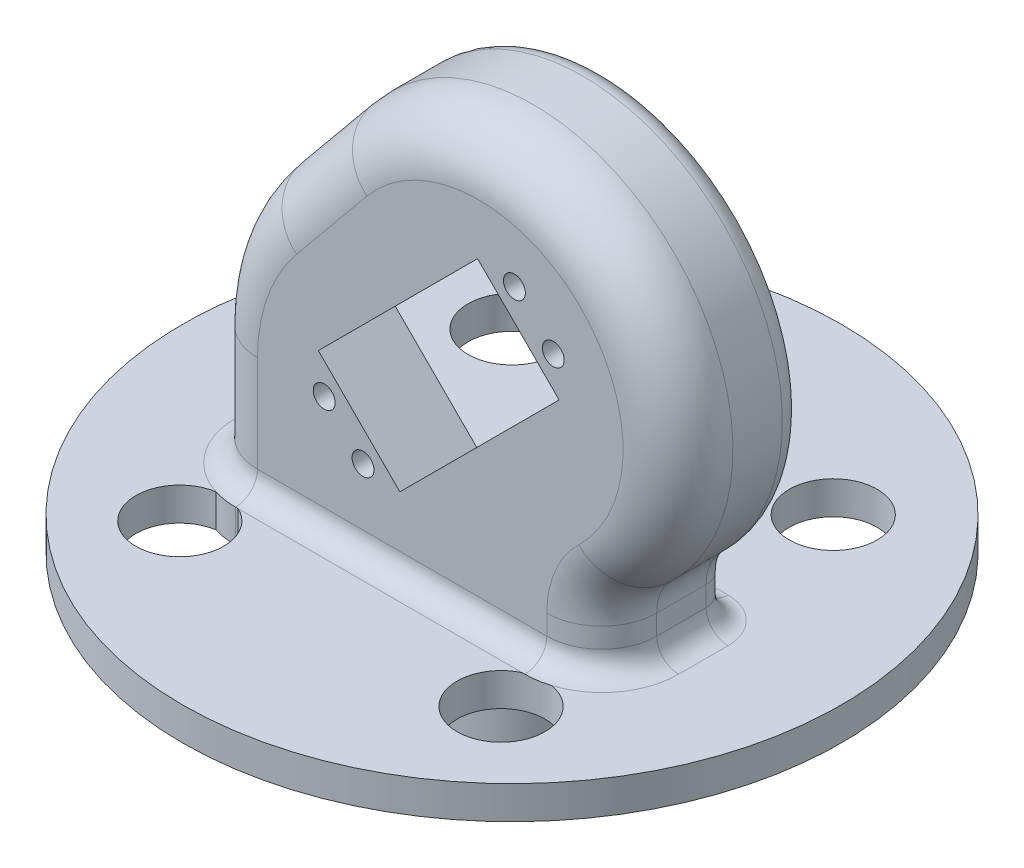
from build123d import *

# Parameters (mm, degrees)
SKETCH1_R                = 59.99999999999994
SKETCH1_R_2              = 1.4999999999999996
BOSS_EXTRUDE2_DEPTH      = 4
BOSS_EXTRUDE3_START      = 6
SKETCH8_R                = 9
BOSS_EXTRUDE3_DEPTH      = 14
SKETCH9_R                = 1.4999999999999996
SKETCH9_R_2              = 1.4999999999999993
BOSS_EXTRUDE4_DEPTH      = 4
BOSS_EXTRUDE8_START      = -23
BOSS_EXTRUDE8_DEPTH      = 23
SKETCH35_R               = 1.6000000000000008
SKETCH35_R_2             = 1.600000000000028
SKETCH35_R_3             = 1.6000000000000338
SKETCH35_R_4             = 1.6000000000000019
CUT_EXTRUDE6_DEPTH       = 14
FILLET1_R                = 10
FILLET2_R                = 4
FILLET3_R                = 4
BOSS_EXTRUDE9_START      = 2
SKETCH40_R               = 59.99999999999994
BOSS_EXTRUDE9_DEPTH      = 2
SKETCH42_R               = 1.9950000000000014
SKETCH42_R_2             = 1.6000000000000008
SKETCH42_R_3             = 1.600000000000028
SKETCH42_R_4             = 1.6000000000000019
SKETCH42_R_5             = 1.9950000000000008
SKETCH42_R_6             = 1.6000000000000336
CUT_EXTRUDE7_DEPTH       = 14
SKETCH44_R               = 12.5
BOSS_EXTRUDE10_DEPTH     = 16
SKETCH46_R               = 1
CUT_EXTRUDE8_DEPTH       = 22
SKETCH47_R               = 1.5
CUT_EXTRUDE9_DEPTH       = 22
SKETCH51_R               = 0.7500000000000002
SKETCH51_R_2             = 0.7500000000000001
SKETCH51_R_3             = 0.7499999999999999
SKETCH51_R_4             = 0.7499999999999998
SKETCH51_R_5             = 0.7499999999999992
SKETCH51_R_6             = 0.75
CUT_EXTRUDE11_DEPTH      = 13.5
SKETCH53_R               = 10.5
CUT_EXTRUDE13_DEPTH      = 2.5
SKETCH55_R               = 2.1
CUT_EXTRUDE14_DEPTH      = 18.5
SKETCH56_R               = 1.5000000000000002
SKETCH56_R_2             = 1.25
BOSS_EXTRUDE12_DEPTH     = 1
SKETCH57_R               = 4.625
CUT_EXTRUDE15_DEPTH      = 0.8
SKETCH58_R               = 15.635
BOSS_EXTRUDE13_DEPTH     = 4
CUT_EXTRUDE16_DEPTH      = 2.5
CUT_EXTRUDE18_DEPTH      = 129.19419354899156
CUT_EXTRUDE18_DEPTH_BACK = 9.5
SKETCH60_R               = 0.7500000000000082
SKETCH60_R_2             = 0.7499999999999998
SKETCH60_R_3             = 0.7500000000000038
SKETCH60_R_4             = 0.7574970144449374
BOSS_EXTRUDE14_START     = 2.5
BOSS_EXTRUDE14_DEPTH     = 2.5
BOSS_EXTRUDE17_START     = 2.5
SKETCH62_R               = 0.7499999999999983
SKETCH62_R_2             = 4.625
SKETCH62_R_3             = 0.7499999999999992
SKETCH62_R_4             = 0.7499999999999998
SKETCH62_R_5             = 0.7500000000000002
SKETCH62_R_6             = 0.75
SKETCH62_R_7             = 0.7500000000000003
SKETCH62_R_8             = 0.7500000000000001
SKETCH62_R_9             = 0.7574970144449374
BOSS_EXTRUDE17_DEPTH     = 2.5
BOSS_EXTRUDE20_START     = 2.5
SKETCH63_R               = 4.625
SKETCH63_R_2             = 1.25
BOSS_EXTRUDE20_DEPTH     = 2.5
SKETCH64_R               = 12.5
SKETCH64_R_2             = 12
CUT_EXTRUDE19_DEPTH      = 14.5
BOSS_EXTRUDE21_START     = 7
BOSS_EXTRUDE21_DEPTH     = 7
BOSS_EXTRUDE22_START     = 7
SKETCH73_R               = 4.625
SKETCH73_R_2             = 0.7499999999999998
SKETCH73_R_3             = 0.75
SKETCH73_R_4             = 0.7500000000000002
SKETCH73_R_5             = 0.7500000000000003
SKETCH73_R_6             = 0.7500000000000001
SKETCH73_R_7             = 0.7574970144449374
SKETCH73_R_8             = 0.7499999999999992
SKETCH73_R_9             = 0.7499999999999983
BOSS_EXTRUDE22_DEPTH     = 7
BOSS_EXTRUDE24_START     = 7
SKETCH74_R               = 4.625
SKETCH74_R_2             = 1.25
BOSS_EXTRUDE24_DEPTH     = 7
CUT_EXTRUDE20_START      = -6
CUT_EXTRUDE20_OUTLINE_R  = 8
CUT_EXTRUDE20_DEPTH      = 6
BOSS_EXTRUDE25_START     = 5.65
BOSS_EXTRUDE25_DEPTH     = 5.65
BOSS_EXTRUDE26_START     = 5.65
SKETCH80_R               = 0.7499999999999998
SKETCH80_R_2             = 0.7500000000000002
SKETCH80_R_3             = 0.7500000000000001
SKETCH80_R_4             = 0.7574970144449374
SKETCH80_R_5             = 0.7499999999999983
SKETCH80_R_6             = 0.7499999999999992
SKETCH80_R_7             = 0.7500000000000003
SKETCH80_R_8             = 0.75
SKETCH80_R_9             = 4.625
BOSS_EXTRUDE26_DEPTH     = 5.65
BOSS_EXTRUDE27_START     = 5.65
SKETCH81_R               = 4.625
SKETCH81_R_2             = 1.25
BOSS_EXTRUDE27_DEPTH     = 5.65
CUT_EXTRUDE21_DEPTH      = 7
SKETCH83_R               = 0.7500000000000002
SKETCH83_R_2             = 0.7500000000000001
SKETCH83_R_3             = 0.7499999999999998
SKETCH83_R_4             = 0.7499999999999992
SKETCH83_R_5             = 0.7500000000000003
SKETCH83_R_6             = 4.625
SKETCH83_R_7             = 0.75
SKETCH83_R_8             = 0.7499999999999983
SKETCH83_R_9             = 0.7574970144449374
CUT_EXTRUDE22_DEPTH      = 7
SKETCH84_R               = 4.625
CUT_EXTRUDE23_DEPTH      = 7


# Read off the part's stored shape, not the designer's step: Boss-Extrude8, Cut-Extrude20
with BuildPart() as part:
    # Sketch1 → Boss-Extrude2 (new body)
    with BuildSketch(Plane(origin=(0, 0, 0), x_dir=(1, 0, 0), z_dir=(0, 1, 0))):
        with Locations(Location((0, 0, 0), (0, 0, 270))):
            Circle(SKETCH1_R)
        with Locations(Location((-2.66e-15, 7.250000000000006, 0), (0, 0, 270))):
            Circle(SKETCH1_R_2, mode=Mode.SUBTRACT)
        with Locations(Location((0, -7.250000000000006, 0), (0, 0, 270))):
            Circle(SKETCH1_R_2, mode=Mode.SUBTRACT)
    extrude(amount=BOSS_EXTRUDE2_DEPTH)

    # Sketch8 → Boss-Extrude3 (add)
    # profile 1 of 2: a face of its own
    with BuildSketch(Plane.XY.offset(BOSS_EXTRUDE3_START)):
        with BuildLine():
            ThreePointArc((-30.34, 25.56864618431717), (-28.274775782359406, 37.45353353362877), (-22.321234896064333, 47.945008610574284))
            Line((-22.321234896064333, 47.945008610574284), (-9.502946601571894, 63.532951239605495))
            ThreePointArc((-9.502946601571894, 63.532951239605495), (34.48863209419088, 66.53673159146734), (34.93556554151656, 22.44498697820235))
            ThreePointArc((34.93556554151656, 22.44498697820235), (31.53662148462827, 17.510838233282723), (30.34, 11.640000000000006))
            Line((30.34, 11.640000000000006), (30.34, 3.999999999999999))
            Line((30.34, 3.999999999999999), (-30.34, 4.000000000000022))
            Line((-30.34, 4.000000000000022), (-30.34, 25.56864618431717))
        make_face()
        with Locations((13.909999999999995, 44.28000000000003)):
            Circle(SKETCH8_R, mode=Mode.SUBTRACT)
    # profile 2 of 2: a face of its own
    with BuildSketch(Plane.XY.offset(BOSS_EXTRUDE3_START)):
        with Locations((13.909999999999995, 44.28000000000003)):
            Circle(SKETCH8_R)
    extrude(amount=BOSS_EXTRUDE3_DEPTH)

    # Sketch9 → Boss-Extrude4 (add)
    with BuildSketch(Plane.XZ):
        with Locations((-2.66e-15, -7.250000000000006)):
            Circle(SKETCH9_R)
        with Locations((-3.1e-16, 7.250000000000006)):
            Circle(SKETCH9_R_2)
    extrude(amount=-BOSS_EXTRUDE4_DEPTH)

    # Boss-Extrude8 outline → Boss-Extrude8 (add)
    with BuildSketch(Plane.XY.offset(20).offset(BOSS_EXTRUDE8_START)):
        with BuildLine():
            Line((-36.34, 4), (-27.34, 4))
            ThreePointArc((-27.34, 4), (-23.163645431, 35.187308549), (-9.502946602, 63.53295124))
            ThreePointArc((-9.502946602, 63.53295124), (34.488632094, 66.536731591), (34.935565542, 22.444986978))
            ThreePointArc((34.935565542, 22.444986978), (31.536621485, 17.510838233), (30.34, 11.64))
            Line((30.34, 11.64), (30.34, 4))
            Line((30.34, 4), (36.34, 4))
            Line((36.34, 4), (36.34, 11.64))
            ThreePointArc((36.34, 11.64), (37.057972891, 15.16250294), (39.097339325, 18.122992187))
            ThreePointArc((39.097339325, 18.122992187), (38.561940438, 70.942200822), (-14.137275565, 67.343855996))
            Line((-14.137275565, 67.343855996), (-26.955563859, 51.755913367))
            ThreePointArc((-26.955563859, 51.755913367), (-33.923048694, 39.477641512), (-36.34, 25.568646184))
            Line((-36.34, 25.568646184), (-36.34, 4))
        make_face()
    extrude(amount=BOSS_EXTRUDE8_DEPTH)

    # Sketch35 → Cut-Extrude6 (cut)
    with BuildSketch(Plane.XY.offset(20)):
        with Locations((20.442578977191182, 60.15066365293005)):
            Circle(SKETCH35_R)
        with Locations((27.513646789056658, 53.07959584106458)):
            Circle(SKETCH35_R_2)
        with Locations((-7.120443353460411, 18.445505698547514)):
            Circle(SKETCH35_R_3)
        with Locations((-14.191511165325878, 25.51657351041299)):
            Circle(SKETCH35_R_4)
        Polygon((-15.259242404917531, 32.227016863873246), (13.73213562373086, 61.218394892521744), (28.581378028648402, 46.369152487604296), (-0.40999999999997444, 17.377774458955773), align=None)
    extrude(amount=-CUT_EXTRUDE6_DEPTH, mode=Mode.SUBTRACT)

    # Fillet1
    fillet1_edges = [part.edges().sort_by_distance(p)[0] for p in [
        (-36.34, 14.784323092, 20),
        (-20.546419712000002, 59.549884681500004, 20),
        (37.05797289097803, 15.162502939948338, 20),
        (36.34, 7.82, 20),
        (38.561940437889646, 70.94220082210202, 20),
        (-33.92304869387061, 39.47764151236106, 20),
    ]]
    fillet(fillet1_edges, radius=FILLET1_R)

    # Fillet2
    fillet2_edges = [part.edges().sort_by_distance(p)[0] for p in [
        (-33.92304869387061, 39.47764151236106, -3),
        (38.561940437889646, 70.94220082210202, -3),
        (-36.34, 14.784323092, -3),
        (-20.546419712000002, 59.549884681500004, -3),
        (37.05797289097803, 15.162502939948338, -3),
        (36.34, 7.82, -3),
    ]]
    fillet(fillet2_edges, radius=FILLET2_R)

    # Fillet3
    fillet3_edges = [part.edges().sort_by_distance(p)[0] for p in [
        (0, 4, 20),
        (33.41106781186548, 4, 17.071067811865476),
        (-33.41106781186548, 4, 17.07106781186548),
        (-29.840000000000003, 4, -3),
        (36.34, 4, 5.5),
        (-36.34, 4, 5.5),
        (35.168427124746195, 4, -1.8284271247461916),
        (-35.168427124746195, 4, -1.8284271247461912),
        (31.34, 4, -3),
    ]]
    fillet(fillet3_edges, radius=FILLET3_R)

    # Sketch40 → Boss-Extrude9 (add)
    with BuildSketch(Plane.XZ.offset(BOSS_EXTRUDE9_START)):
        with Locations(Location((0, 0, 0), (0, 0, 270))):
            Circle(SKETCH40_R)
    extrude(amount=-BOSS_EXTRUDE9_DEPTH)

    # Sketch42 → Cut-Extrude7 (cut)
    # profile 1 of 4: a face of its own
    with BuildSketch(Plane.XY.offset(20)):
        with Locations((20.442578977191182, 60.15066365293005)):
            Circle(SKETCH42_R)
        with Locations((20.442578977191182, 60.15066365293005)):
            Circle(SKETCH42_R_2, mode=Mode.SUBTRACT)
    # profile 2 of 4: a face of its own
    with BuildSketch(Plane.XY.offset(20)):
        with Locations((27.513646789056658, 53.07959584106458)):
            Circle(SKETCH42_R)
        with Locations((27.513646789056658, 53.07959584106458)):
            Circle(SKETCH42_R_3, mode=Mode.SUBTRACT)
    # profile 3 of 4: a face of its own
    with BuildSketch(Plane.XY.offset(20)):
        with Locations((-14.191511165325878, 25.51657351041299)):
            Circle(SKETCH42_R)
        with Locations((-14.191511165325878, 25.51657351041299)):
            Circle(SKETCH42_R_4, mode=Mode.SUBTRACT)
    # profile 4 of 4: a face of its own
    with BuildSketch(Plane.XY.offset(20)):
        with Locations((-7.120443353460411, 18.445505698547514)):
            Circle(SKETCH42_R_5)
        with Locations((-7.120443353460411, 18.445505698547514)):
            Circle(SKETCH42_R_6, mode=Mode.SUBTRACT)
    extrude(amount=-CUT_EXTRUDE7_DEPTH, mode=Mode.SUBTRACT)

    # Sketch44 → Boss-Extrude10 (add)
    with BuildSketch(Plane.XZ.offset(2)):
        with Locations(Location((0, 0, 0), (0, 0, 270))):
            Circle(SKETCH44_R)
    extrude(amount=BOSS_EXTRUDE10_DEPTH)

    # Sketch46 → Cut-Extrude8 (cut)
    with BuildSketch(Plane.XZ.offset(18.000000000000004)):
        with Locations(Location((0, 0, 0), (0, 0, 270))):
            Circle(SKETCH46_R)
    extrude(amount=-CUT_EXTRUDE8_DEPTH, mode=Mode.SUBTRACT)

    # Sketch47 → Cut-Extrude9 (cut)
    with BuildSketch(Plane.XZ.offset(18.000000000000004)):
        with Locations(Location((0, 0, 0), (0, 0, 270))):
            Circle(SKETCH47_R)
    extrude(amount=-CUT_EXTRUDE9_DEPTH, mode=Mode.SUBTRACT)

    # Sketch51 → Cut-Extrude11 (cut)
    with BuildSketch(Plane.XZ.offset(18.000000000000004)):
        with Locations(Location((-7.5, -9.2e-16, 0), (0, 0, 270))):
            Circle(SKETCH51_R)
        with Locations(Location((-7.500000000000011, 3.1999999999999993, 0), (0, 0, 270))):
            Circle(SKETCH51_R_2)
        with Locations(Location((7.5, -9.2e-16, 0), (0, 0, 90))):
            Circle(SKETCH51_R)
        with Locations(Location((7.500000000000011, 3.1999999999999993, 0), (0, 0, 90))):
            Circle(SKETCH51_R_2)
        with Locations(Location((0, 7.5, 0), (0, 0, 270))):
            Circle(SKETCH51_R_3)
        with Locations(Location((3.2, 7.5, 0), (0, 0, 270))):
            Circle(SKETCH51_R_4)
        with Locations(Location((-3.2, 7.5, 0), (0, 0, 90))):
            Circle(SKETCH51_R_4)
        with Locations(Location((3.200000000000002, -7.5, 0), (0, 0, 90))):
            Circle(SKETCH51_R_5)
        with Locations(Location((1.84e-15, -7.5, 0), (0, 0, 90))):
            Circle(SKETCH51_R_6)
        with Locations(Location((-3.1999999999999984, -7.5, 0), (0, 0, 270))):
            Circle(SKETCH51_R)
        with Locations(Location((7.500000000000011, -3.1999999999999975, 0), (0, 0, 270))):
            Circle(SKETCH51_R_2)
        with Locations(Location((-7.500000000000011, -3.200000000000001, 0), (0, 0, 90))):
            Circle(SKETCH51_R_2)
    extrude(amount=-CUT_EXTRUDE11_DEPTH, mode=Mode.SUBTRACT)

    # Sketch53 → Cut-Extrude13 (cut)
    with BuildSketch(Plane.XZ.offset(18.000000000000004)):
        with Locations(Location((0, 0, 0), (0, 0, 270))):
            Circle(SKETCH53_R)
    extrude(amount=-CUT_EXTRUDE13_DEPTH, mode=Mode.SUBTRACT)

    # Sketch55 → Cut-Extrude14 (cut)
    with BuildSketch(Plane(origin=(0, 4, 0), x_dir=(1, 0, 0), z_dir=(0, 1, 0))):
        with Locations(Location((0, 0, 0), (0, 0, 270))):
            Circle(SKETCH55_R)
    extrude(amount=-CUT_EXTRUDE14_DEPTH, mode=Mode.SUBTRACT)

    # Sketch56 → Boss-Extrude12 (add)
    with BuildSketch(Plane.XZ.offset(15.500000000000002)):
        Circle(SKETCH56_R)
        with Locations(Location((0, 0, 0), (0, 0, 270))):
            Circle(SKETCH56_R_2, mode=Mode.SUBTRACT)
    extrude(amount=-BOSS_EXTRUDE12_DEPTH)

    # Sketch57 → Cut-Extrude15 (cut)
    with BuildSketch(Plane.XZ.offset(15.500000000000002)):
        with Locations(Location((0, 0, 0), (0, 0, 270))):
            Circle(SKETCH57_R)
    extrude(amount=-CUT_EXTRUDE15_DEPTH, mode=Mode.SUBTRACT)

    # Sketch58 → Boss-Extrude13 (add)
    with BuildSketch(Plane.XZ.offset(2)):
        with Locations(Location((0, 0, 0), (0, 0, 270))):
            Circle(SKETCH58_R)
    extrude(amount=BOSS_EXTRUDE13_DEPTH)

    # Sketch59 → Cut-Extrude16 (cut)
    with BuildSketch(Plane.XZ.offset(18.000000000000004)):
        with BuildLine():
            ThreePointArc((-0.7156378338798501, 10.47558411214955), (3.707e-14, 11.45), (0.7156378338799193, 10.475584112149546))
            ThreePointArc((0.7156378338799211, 10.47558411214953), (2.5583579679476944, 10.183555592612954), (4.320303648370152, 9.570003990901965))
            Line((4.320303648369849, 9.570003990901801), (3.949567138225232, 11.859634034009925))
            ThreePointArc((3.9495671382254676, 11.85963403401005), (0, 12.5), (-3.9495671382254685, 11.85963403401005))
            Line((-3.949567138225234, 11.859634034009925), (-4.320303648369851, 9.5700039909018))
            ThreePointArc((-4.320303648370155, 9.570003990901965), (-2.5583579679476625, 10.183555592612962), (-0.7156378338798519, 10.475584112149535))
        make_face()
        with BuildLine():
            Line((11.859285638591711, 3.9506131349821465), (9.569850472212527, 4.320643695040924))
            ThreePointArc((9.569850472212437, 4.320643695040755), (10.183510138146612, 2.5585388928576367), (10.475584112149534, 0.7156378338798652))
            ThreePointArc((10.475584112149527, 0.7156378338798668), (11.449999999999998, -1.039e-14), (10.475584112149525, -0.7156378338798851))
            ThreePointArc((10.475584112149532, -0.7156378338798884), (10.183510138146612, -2.5585388928576354), (9.569850472212446, -4.320643695040731))
            Line((9.569850472212538, -4.320643695040902), (11.859285638591727, -3.950613134982127))
            ThreePointArc((11.859285638591693, -3.9506131349820652), (12.5, 1.688e-14), (11.859285638591682, 3.9506131349820977))
        make_face()
        with BuildLine():
            Line((-9.569850472212531, 4.320643695040917), (-11.859285638591711, 3.9506131349821394))
            ThreePointArc((-11.859285638591686, 3.9506131349820888), (-12.5, -1.78e-15), (-11.859285638591684, -3.9506131349820928))
            Line((-11.859285638591713, -3.9506131349821443), (-9.569850472212533, -4.320643695040918))
            ThreePointArc((-9.569850472212439, -4.320643695040749), (-10.183510138146609, -2.5585388928576465), (-10.475584112149532, -0.7156378338798928))
            ThreePointArc((-10.475584112149509, -0.7156378338798963), (-11.45, -2.526e-14), (-10.475584112149512, 0.7156378338798508))
            ThreePointArc((-10.475584112149535, 0.7156378338798486), (-10.183510138146614, 2.5585388928576247), (-9.569850472212439, 4.320643695040748))
        make_face()
        with BuildLine():
            Line((3.949567138225234, -11.859634034009918), (4.320303648369745, -9.570003990902453))
            ThreePointArc((4.320303648369439, -9.570003990902288), (2.5583579679473134, -10.183555592613049), (0.7156378338799181, -10.47558411214953))
            ThreePointArc((0.7156378338799191, -10.475584112149544), (3.849e-14, -11.45), (-0.7156378338798507, -10.475584112149551))
            ThreePointArc((-0.7156378338798586, -10.475584112149535), (-2.558357967947286, -10.183555592613057), (-4.320303648369443, -9.570003990902286))
            Line((-4.320303648369746, -9.570003990902451), (-3.949567138225234, -11.859634034009925))
            ThreePointArc((-3.9495671382254716, -11.85963403401005), (1.78e-15, -12.500000000000002), (3.9495671382254742, -11.85963403401005))
        make_face()
    extrude(amount=-CUT_EXTRUDE16_DEPTH, mode=Mode.SUBTRACT)

    # Sketch60 → Cut-Extrude18 (cut, two sides: drawn at the far end of the back side and taken through both)
    with BuildSketch(Plane.XZ.offset(15.500000000000002).offset(-CUT_EXTRUDE18_DEPTH_BACK)):
        with Locations(Location((3.516e-14, 10.7, 0), (0, 0, 270))):
            Circle(SKETCH60_R)
        with Locations(Location((3.516e-14, -10.7, 0), (0, 0, 270))):
            Circle(SKETCH60_R_2)
        with Locations(Location((10.7, -9.39e-15, 0), (0, 0, 270))):
            Circle(SKETCH60_R_3)
        with Locations(Location((-10.7, -2.326e-14, 0), (0, 0, 270))):
            Circle(SKETCH60_R_4)
    extrude(amount=CUT_EXTRUDE18_DEPTH + CUT_EXTRUDE18_DEPTH_BACK, mode=Mode.SUBTRACT)

    # Sketch61 → Boss-Extrude14 (add)
    with BuildSketch(Plane.XZ.offset(18.000000000000004).offset(BOSS_EXTRUDE14_START)):
        with BuildLine():
            Line((3.949567138225199, 11.859634034010142), (4.320303648369798, 9.570003990902128))
            ThreePointArc((4.320303648369798, 9.570003990902128), (7.4244892923568955, 7.424753110217054), (9.569850472212346, 4.320643695040953))
            Line((9.569850472212346, 4.320643695040953), (11.859285638591667, 3.9506131349821545))
            ThreePointArc((11.859285638591667, 3.9506131349821545), (8.838444966456654, 8.839224546017435), (3.949567138225199, 11.859634034010142))
        make_face()
        with BuildLine():
            Line((11.859285638591672, -3.9506131349821385), (9.569850472212357, -4.3206436950409355))
            ThreePointArc((9.569850472212357, -4.3206436950409355), (7.424489292356904, -7.424753110217047), (4.320303648369799, -9.570003990902128))
            Line((4.320303648369799, -9.570003990902128), (3.9495671382252, -11.859634034010142))
            ThreePointArc((3.9495671382252, -11.859634034010142), (8.83844496645666, -8.83922454601743), (11.859285638591672, -3.9506131349821385))
        make_face()
        with BuildLine():
            Line((-3.9495671382252016, -11.859634034010142), (-4.3203036483698005, -9.570003990902128))
            ThreePointArc((-4.3203036483698005, -9.570003990902128), (-7.4244892923568955, -7.424753110217051), (-9.569850472212346, -4.320643695040949))
            Line((-9.569850472212346, -4.320643695040949), (-11.859285638591667, -3.9506131349821536))
            ThreePointArc((-11.859285638591667, -3.9506131349821536), (-8.838444966456654, -8.839224546017435), (-3.9495671382252016, -11.859634034010142))
        make_face()
        with BuildLine():
            Line((-11.859285638591668, 3.9506131349821474), (-9.56985047221235, 4.320643695040947))
            ThreePointArc((-9.56985047221235, 4.320643695040947), (-7.424489292356899, 7.424753110217049), (-4.320303648369798, 9.570003990902126))
            Line((-4.320303648369798, 9.570003990902126), (-3.949567138225198, 11.85963403401014))
            ThreePointArc((-3.949567138225198, 11.85963403401014), (-8.838444966456656, 8.839224546017428), (-11.859285638591668, 3.9506131349821474))
        make_face()
    extrude(amount=-BOSS_EXTRUDE14_DEPTH)

    # Sketch62 → Boss-Extrude17 (add)
    with BuildSketch(Plane.XZ.offset(15.500000000000002).offset(BOSS_EXTRUDE17_START)):
        with BuildLine():
            Line((-11.859285638591667, -3.9506131349821545), (-9.569850472212352, -4.320643695040947))
            ThreePointArc((-9.569850472212352, -4.320643695040947), (-7.424489292356899, -7.424753110217055), (-4.320303648369798, -9.570003990902128))
            Line((-4.320303648369798, -9.570003990902128), (-3.9495671382252, -11.85963403401014))
            ThreePointArc((-3.9495671382252, -11.85963403401014), (7.7e-16, -12.500000000000002), (3.949567138225199, -11.85963403401014))
            Line((3.949567138225199, -11.85963403401014), (4.320303648369799, -9.570003990902126))
            ThreePointArc((4.320303648369799, -9.570003990902126), (7.424489292356904, -7.424753110217047), (9.569850472212355, -4.320643695040933))
            Line((9.569850472212355, -4.320643695040933), (11.859285638591672, -3.9506131349821376))
            ThreePointArc((11.859285638591672, -3.9506131349821376), (12.500000000000004, 9.71e-15), (11.859285638591667, 3.950613134982156))
            Line((11.859285638591667, 3.950613134982156), (9.56985047221235, 4.320643695040952))
            ThreePointArc((9.56985047221235, 4.320643695040952), (7.424489292356898, 7.424753110217056), (4.320303648369796, 9.570003990902128))
            Line((4.320303648369796, 9.570003990902128), (3.949567138225198, 11.85963403401014))
            ThreePointArc((3.949567138225198, 11.85963403401014), (7.7e-16, 12.5), (-3.9495671382252, 11.85963403401014))
            Line((-3.9495671382252, 11.85963403401014), (-4.320303648369798, 9.570003990902128))
            ThreePointArc((-4.320303648369798, 9.570003990902128), (-7.4244892923569, 7.4247531102170505), (-9.569850472212353, 4.320643695040945))
            Line((-9.569850472212353, 4.320643695040945), (-11.859285638591668, 3.950613134982149))
            ThreePointArc((-11.859285638591668, 3.950613134982149), (-12.500000000000004, -4.02e-15), (-11.859285638591667, -3.9506131349821545))
        make_face()
        with Locations(Location((10.7, -9.39e-15, 0), (0, 0, 270))):
            Circle(SKETCH62_R, mode=Mode.SUBTRACT)
        with Locations(Location((0, 0, 0), (0, 0, 270))):
            Circle(SKETCH62_R_2, mode=Mode.SUBTRACT)
        with Locations(Location((3.200000000000002, -7.5, 0), (0, 0, 270))):
            Circle(SKETCH62_R_3, mode=Mode.SUBTRACT)
        with Locations(Location((3.2, 7.5, 0), (0, 0, 270))):
            Circle(SKETCH62_R_4, mode=Mode.SUBTRACT)
        with Locations(Location((7.5, -9.2e-16, 0), (0, 0, 270))):
            Circle(SKETCH62_R_5, mode=Mode.SUBTRACT)
        with Locations(Location((0, 7.5, 0), (0, 0, 270))):
            Circle(SKETCH62_R_6, mode=Mode.SUBTRACT)
        with Locations(Location((7.500000000000011, -3.1999999999999975, 0), (0, 0, 270))):
            Circle(SKETCH62_R_5, mode=Mode.SUBTRACT)
        with Locations(Location((-7.5, -9.2e-16, 0), (0, 0, 270))):
            Circle(SKETCH62_R_5, mode=Mode.SUBTRACT)
        with Locations(Location((-7.500000000000011, -3.200000000000001, 0), (0, 0, 270))):
            Circle(SKETCH62_R_5, mode=Mode.SUBTRACT)
        with Locations(Location((-3.1999999999999984, -7.5, 0), (0, 0, 270))):
            Circle(SKETCH62_R_7, mode=Mode.SUBTRACT)
        with Locations(Location((7.500000000000011, 3.1999999999999993, 0), (0, 0, 270))):
            Circle(SKETCH62_R_5, mode=Mode.SUBTRACT)
        with Locations(Location((-7.500000000000011, 3.1999999999999993, 0), (0, 0, 270))):
            Circle(SKETCH62_R_5, mode=Mode.SUBTRACT)
        with Locations(Location((-3.2, 7.5, 0), (0, 0, 270))):
            Circle(SKETCH62_R_4, mode=Mode.SUBTRACT)
        with Locations(Location((1.84e-15, -7.5, 0), (0, 0, 270))):
            Circle(SKETCH62_R_8, mode=Mode.SUBTRACT)
        with Locations(Location((3.516e-14, -10.7, 0), (0, 0, 270))):
            Circle(SKETCH62_R_8, mode=Mode.SUBTRACT)
        with Locations(Location((3.516e-14, 10.7, 0), (0, 0, 270))):
            Circle(SKETCH62_R_8, mode=Mode.SUBTRACT)
        with Locations(Location((-10.7, -2.326e-14, 0), (0, 0, 270))):
            Circle(SKETCH62_R_9, mode=Mode.SUBTRACT)
    extrude(amount=-BOSS_EXTRUDE17_DEPTH)

    # Sketch63 → Boss-Extrude20 (add)
    with BuildSketch(Plane.XZ.offset(14.700000000000001).offset(BOSS_EXTRUDE20_START)):
        with Locations(Location((0, 0, 0), (0, 0, 270))):
            Circle(SKETCH63_R)
        with Locations(Location((0, 0, 0), (0, 0, 270))):
            Circle(SKETCH63_R_2, mode=Mode.SUBTRACT)
    extrude(amount=-BOSS_EXTRUDE20_DEPTH)

    # Sketch64 → Cut-Extrude19 (cut)
    with BuildSketch(Plane.XZ.offset(20.5)):
        Circle(SKETCH64_R)
        with Locations(Location((0, 0, 0), (0, 0, 270))):
            Circle(SKETCH64_R_2, mode=Mode.SUBTRACT)
    extrude(amount=-CUT_EXTRUDE19_DEPTH, mode=Mode.SUBTRACT)

    # Sketch72 → Boss-Extrude21 (add)
    with BuildSketch(Plane.XZ.offset(20.5).offset(BOSS_EXTRUDE21_START)):
        with BuildLine():
            Line((4.3203036483698, -9.57000399090213), (4.040282450144906, -11.299385723261734))
            ThreePointArc((4.040282450144906, -11.299385723261734), (8.48495273086531, -8.485610004883641), (11.299072727121294, -4.041157693931754))
            Line((11.299072727121294, -4.041157693931754), (9.569850472212359, -4.3206436950409355))
            ThreePointArc((9.569850472212359, -4.3206436950409355), (7.424489292356907, -7.42475311021705), (4.3203036483698, -9.57000399090213))
        make_face()
        with BuildLine():
            Line((9.569850472212346, 4.320643695040954), (11.299072727121288, 4.041157693931771))
            ThreePointArc((11.299072727121288, 4.041157693931771), (8.484952730865304, 8.485610004883648), (4.040282450144905, 11.299385723261736))
            Line((4.040282450144905, 11.299385723261736), (4.320303648369798, 9.57000399090213))
            ThreePointArc((4.320303648369798, 9.57000399090213), (7.4244892923568955, 7.424753110217054), (9.569850472212346, 4.320643695040954))
        make_face()
        with BuildLine():
            Line((-9.569850472212352, -4.320643695040945), (-11.299072727121288, -4.041157693931767))
            ThreePointArc((-11.299072727121288, -4.041157693931767), (-8.484952730865304, -8.485610004883647), (-4.040282450144907, -11.299385723261734))
            Line((-4.040282450144907, -11.299385723261734), (-4.320303648369805, -9.570003990902125))
            ThreePointArc((-4.320303648369805, -9.570003990902125), (-7.4244892923569035, -7.424753110217047), (-9.569850472212352, -4.320643695040945))
        make_face()
        with BuildLine():
            Line((-4.320303648369798, 9.570003990902128), (-4.040282450144903, 11.299385723261736))
            ThreePointArc((-4.040282450144903, 11.299385723261736), (-8.484952730865304, 8.485610004883647), (-11.29907272712129, 4.041157693931762))
            Line((-11.29907272712129, 4.041157693931762), (-9.569850472212348, 4.320643695040946))
            ThreePointArc((-9.569850472212348, 4.320643695040946), (-7.424489292356898, 7.424753110217054), (-4.320303648369798, 9.570003990902128))
        make_face()
    extrude(amount=-BOSS_EXTRUDE21_DEPTH)

    # Sketch73 → Boss-Extrude22 (add)
    with BuildSketch(Plane.XZ.offset(18.000000000000004).offset(BOSS_EXTRUDE22_START)):
        with BuildLine():
            ThreePointArc((4.320303648369798, -9.570003990902126), (7.424489292356904, -7.424753110217044), (9.569850472212355, -4.320643695040931))
            Line((9.569850472212355, -4.320643695040931), (11.299072727121295, -4.041157693931754))
            ThreePointArc((11.299072727121295, -4.041157693931754), (12.000000000000004, 8.66e-15), (11.299072727121288, 4.04115769393177))
            Line((11.299072727121288, 4.04115769393177), (9.569850472212346, 4.320643695040952))
            ThreePointArc((9.569850472212346, 4.320643695040952), (7.4244892923568955, 7.424753110217054), (4.320303648369797, 9.570003990902128))
            Line((4.320303648369797, 9.570003990902128), (4.040282450144904, 11.299385723261738))
            ThreePointArc((4.040282450144904, 11.299385723261738), (7.3e-16, 12.000000000000004), (-4.040282450144903, 11.299385723261736))
            Line((-4.040282450144903, 11.299385723261736), (-4.3203036483698, 9.570003990902126))
            ThreePointArc((-4.3203036483698, 9.570003990902126), (-7.4244892923569, 7.4247531102170505), (-9.56985047221235, 4.320643695040946))
            Line((-9.56985047221235, 4.320643695040946), (-11.299072727121292, 4.041157693931763))
            ThreePointArc((-11.299072727121292, 4.041157693931763), (-12.000000000000004, 1.47e-15), (-11.299072727121288, -4.041157693931768))
            Line((-11.299072727121288, -4.041157693931768), (-9.569850472212348, -4.320643695040947))
            ThreePointArc((-9.569850472212348, -4.320643695040947), (-7.424489292356899, -7.424753110217049), (-4.3203036483698, -9.570003990902126))
            Line((-4.3203036483698, -9.570003990902126), (-4.040282450144904, -11.29938572326174))
            ThreePointArc((-4.040282450144904, -11.29938572326174), (7.3e-16, -12.000000000000005), (4.040282450144905, -11.299385723261738))
            Line((4.040282450144905, -11.299385723261738), (4.320303648369798, -9.570003990902126))
        make_face()
        with Locations(Location((0, 0, 0), (0, 0, 270))):
            Circle(SKETCH73_R, mode=Mode.SUBTRACT)
        with Locations(Location((3.2, 7.5, 0), (0, 0, 270))):
            Circle(SKETCH73_R_2, mode=Mode.SUBTRACT)
        with Locations(Location((0, 7.5, 0), (0, 0, 270))):
            Circle(SKETCH73_R_3, mode=Mode.SUBTRACT)
        with Locations(Location((-7.5, -9.2e-16, 0), (0, 0, 270))):
            Circle(SKETCH73_R_4, mode=Mode.SUBTRACT)
        with Locations(Location((-3.1999999999999984, -7.5, 0), (0, 0, 270))):
            Circle(SKETCH73_R_5, mode=Mode.SUBTRACT)
        with Locations(Location((-7.500000000000011, 3.1999999999999993, 0), (0, 0, 270))):
            Circle(SKETCH73_R_4, mode=Mode.SUBTRACT)
        with Locations(Location((1.84e-15, -7.5, 0), (0, 0, 270))):
            Circle(SKETCH73_R_6, mode=Mode.SUBTRACT)
        with Locations(Location((3.516e-14, 10.7, 0), (0, 0, 270))):
            Circle(SKETCH73_R_6, mode=Mode.SUBTRACT)
        with Locations(Location((-10.7, -2.326e-14, 0), (0, 0, 270))):
            Circle(SKETCH73_R_7, mode=Mode.SUBTRACT)
        with Locations(Location((3.516e-14, -10.7, 0), (0, 0, 270))):
            Circle(SKETCH73_R_6, mode=Mode.SUBTRACT)
        with Locations(Location((-3.2, 7.5, 0), (0, 0, 270))):
            Circle(SKETCH73_R_2, mode=Mode.SUBTRACT)
        with Locations(Location((7.500000000000011, 3.1999999999999993, 0), (0, 0, 270))):
            Circle(SKETCH73_R_4, mode=Mode.SUBTRACT)
        with Locations(Location((-7.500000000000011, -3.200000000000001, 0), (0, 0, 270))):
            Circle(SKETCH73_R_4, mode=Mode.SUBTRACT)
        with Locations(Location((7.500000000000011, -3.1999999999999975, 0), (0, 0, 270))):
            Circle(SKETCH73_R_4, mode=Mode.SUBTRACT)
        with Locations(Location((7.5, -9.2e-16, 0), (0, 0, 270))):
            Circle(SKETCH73_R_4, mode=Mode.SUBTRACT)
        with Locations(Location((3.200000000000002, -7.5, 0), (0, 0, 270))):
            Circle(SKETCH73_R_8, mode=Mode.SUBTRACT)
        with Locations(Location((10.7, -9.39e-15, 0), (0, 0, 270))):
            Circle(SKETCH73_R_9, mode=Mode.SUBTRACT)
    extrude(amount=-BOSS_EXTRUDE22_DEPTH)

    # Sketch74 → Boss-Extrude24 (add)
    with BuildSketch(Plane.XZ.offset(17.2).offset(BOSS_EXTRUDE24_START)):
        with Locations(Location((0, 0, 0), (0, 0, 270))):
            Circle(SKETCH74_R)
        with Locations(Location((0, 0, 0), (0, 0, 270))):
            Circle(SKETCH74_R_2, mode=Mode.SUBTRACT)
    extrude(amount=-BOSS_EXTRUDE24_DEPTH)

    # Cut-Extrude20 outline → Cut-Extrude20 (cut)
    with BuildSketch(Plane(origin=(0, 4, 0), x_dir=(1, 0, 0), z_dir=(0, 1, 0)).offset(CUT_EXTRUDE20_START)):
        with Locations((29.244353814, 29.239829477)):
            Circle(CUT_EXTRUDE20_OUTLINE_R)
        with Locations((-29.244353814, 29.239829477)):
            Circle(CUT_EXTRUDE20_OUTLINE_R)
        with BuildLine():
            ThreePointArc((-30.560183964, -23.348784488), (-30.337868256, -39.164741222), (-25.840698551, -24))
            Line((-25.840698551, -24), (-26.34, -24))
            ThreePointArc((-26.34, -24), (-28.475066412, -23.836238341), (-30.560183964, -23.348784488))
        make_face()
        with Locations((29.244353814, -31.239829477)):
            Circle(CUT_EXTRUDE20_OUTLINE_R)
    extrude(amount=CUT_EXTRUDE20_DEPTH, mode=Mode.SUBTRACT)

    # Sketch78 → Boss-Extrude25 (add)
    with BuildSketch(Plane.XZ.offset(27.5).offset(BOSS_EXTRUDE25_START)):
        with BuildLine():
            Line((-4.320303648369797, 9.570003990902128), (-4.040282450144903, 11.299385723261736))
            ThreePointArc((-4.040282450144903, 11.299385723261736), (-8.484952730865304, 8.485610004883647), (-11.29907272712129, 4.0411576939317655))
            Line((-11.29907272712129, 4.0411576939317655), (-9.56985047221235, 4.320643695040948))
            ThreePointArc((-9.56985047221235, 4.320643695040948), (-7.424489292356898, 7.424753110217054), (-4.320303648369797, 9.570003990902128))
        make_face()
        with BuildLine():
            Line((-9.569850472212352, -4.320643695040945), (-11.299072727121288, -4.041157693931767))
            ThreePointArc((-11.299072727121288, -4.041157693931767), (-8.484952730865304, -8.485610004883647), (-4.040282450144906, -11.299385723261736))
            Line((-4.040282450144906, -11.299385723261736), (-4.320303648369805, -9.570003990902125))
            ThreePointArc((-4.320303648369805, -9.570003990902125), (-7.4244892923569035, -7.424753110217047), (-9.569850472212352, -4.320643695040945))
        make_face()
        with BuildLine():
            Line((4.3203036483698, -9.57000399090213), (4.040282450144906, -11.299385723261734))
            ThreePointArc((4.040282450144906, -11.299385723261734), (8.48495273086531, -8.485610004883641), (11.299072727121294, -4.041157693931754))
            Line((11.299072727121294, -4.041157693931754), (9.569850472212359, -4.3206436950409355))
            ThreePointArc((9.569850472212359, -4.3206436950409355), (7.424489292356907, -7.42475311021705), (4.3203036483698, -9.57000399090213))
        make_face()
        with BuildLine():
            Line((9.569850472212346, 4.320643695040954), (11.299072727121288, 4.041157693931771))
            ThreePointArc((11.299072727121288, 4.041157693931771), (8.484952730865304, 8.485610004883648), (4.040282450144905, 11.299385723261736))
            Line((4.040282450144905, 11.299385723261736), (4.320303648369798, 9.57000399090213))
            ThreePointArc((4.320303648369798, 9.57000399090213), (7.4244892923568955, 7.424753110217054), (9.569850472212346, 4.320643695040954))
        make_face()
    extrude(amount=-BOSS_EXTRUDE25_DEPTH)

    # Sketch80 → Boss-Extrude26 (add)
    with BuildSketch(Plane.XZ.offset(25).offset(BOSS_EXTRUDE26_START)):
        with BuildLine():
            Line((4.040282450144904, -11.299385723261738), (4.320303648369798, -9.570003990902126))
            ThreePointArc((4.320303648369798, -9.570003990902126), (7.424489292356904, -7.424753110217044), (9.569850472212355, -4.320643695040931))
            Line((9.569850472212355, -4.320643695040931), (11.299072727121295, -4.041157693931749))
            ThreePointArc((11.299072727121295, -4.041157693931749), (12.000000000000002, 9.99e-15), (11.299072727121288, 4.041157693931768))
            Line((11.299072727121288, 4.041157693931768), (9.569850472212346, 4.320643695040952))
            ThreePointArc((9.569850472212346, 4.320643695040952), (7.4244892923568955, 7.424753110217054), (4.320303648369797, 9.570003990902128))
            Line((4.320303648369797, 9.570003990902128), (4.040282450144903, 11.299385723261738))
            ThreePointArc((4.040282450144903, 11.299385723261738), (7.3e-16, 12.000000000000004), (-4.040282450144905, 11.299385723261738))
            Line((-4.040282450144905, 11.299385723261738), (-4.3203036483698, 9.570003990902126))
            ThreePointArc((-4.3203036483698, 9.570003990902126), (-7.4244892923569, 7.4247531102170505), (-9.56985047221235, 4.320643695040946))
            Line((-9.56985047221235, 4.320643695040946), (-11.29907272712129, 4.041157693931762))
            ThreePointArc((-11.29907272712129, 4.041157693931762), (-12.000000000000002, 1.47e-15), (-11.299072727121288, -4.041157693931766))
            Line((-11.299072727121288, -4.041157693931766), (-9.569850472212348, -4.320643695040947))
            ThreePointArc((-9.569850472212348, -4.320643695040947), (-7.424489292356899, -7.424753110217049), (-4.3203036483698, -9.570003990902126))
            Line((-4.3203036483698, -9.570003990902126), (-4.040282450144906, -11.299385723261736))
            ThreePointArc((-4.040282450144906, -11.299385723261736), (7.3e-16, -12.000000000000002), (4.040282450144904, -11.299385723261738))
        make_face()
        with Locations(Location((3.2, 7.5, 0), (0, 0, 270))):
            Circle(SKETCH80_R, mode=Mode.SUBTRACT)
        with Locations(Location((-7.5, -9.2e-16, 0), (0, 0, 270))):
            Circle(SKETCH80_R_2, mode=Mode.SUBTRACT)
        with Locations(Location((-7.500000000000011, 3.1999999999999993, 0), (0, 0, 270))):
            Circle(SKETCH80_R_2, mode=Mode.SUBTRACT)
        with Locations(Location((3.516e-14, 10.7, 0), (0, 0, 270))):
            Circle(SKETCH80_R_3, mode=Mode.SUBTRACT)
        with Locations(Location((-10.7, -2.326e-14, 0), (0, 0, 270))):
            Circle(SKETCH80_R_4, mode=Mode.SUBTRACT)
        with Locations(Location((-3.2, 7.5, 0), (0, 0, 270))):
            Circle(SKETCH80_R, mode=Mode.SUBTRACT)
        with Locations(Location((-7.500000000000011, -3.200000000000001, 0), (0, 0, 270))):
            Circle(SKETCH80_R_2, mode=Mode.SUBTRACT)
        with Locations(Location((7.5, -9.2e-16, 0), (0, 0, 270))):
            Circle(SKETCH80_R_2, mode=Mode.SUBTRACT)
        with Locations(Location((10.7, -9.39e-15, 0), (0, 0, 270))):
            Circle(SKETCH80_R_5, mode=Mode.SUBTRACT)
        with Locations(Location((3.200000000000002, -7.5, 0), (0, 0, 270))):
            Circle(SKETCH80_R_6, mode=Mode.SUBTRACT)
        with Locations(Location((7.500000000000011, -3.1999999999999975, 0), (0, 0, 270))):
            Circle(SKETCH80_R_2, mode=Mode.SUBTRACT)
        with Locations(Location((7.500000000000011, 3.1999999999999993, 0), (0, 0, 270))):
            Circle(SKETCH80_R_2, mode=Mode.SUBTRACT)
        with Locations(Location((3.516e-14, -10.7, 0), (0, 0, 270))):
            Circle(SKETCH80_R_3, mode=Mode.SUBTRACT)
        with Locations(Location((1.84e-15, -7.5, 0), (0, 0, 270))):
            Circle(SKETCH80_R_3, mode=Mode.SUBTRACT)
        with Locations(Location((-3.1999999999999984, -7.5, 0), (0, 0, 270))):
            Circle(SKETCH80_R_7, mode=Mode.SUBTRACT)
        with Locations(Location((0, 7.5, 0), (0, 0, 270))):
            Circle(SKETCH80_R_8, mode=Mode.SUBTRACT)
        with Locations(Location((0, 0, 0), (0, 0, 270))):
            Circle(SKETCH80_R_9, mode=Mode.SUBTRACT)
    extrude(amount=-BOSS_EXTRUDE26_DEPTH)

    # Sketch81 → Boss-Extrude27 (add)
    with BuildSketch(Plane.XZ.offset(24.2).offset(BOSS_EXTRUDE27_START)):
        with Locations(Location((0, 0, 0), (0, 0, 270))):
            Circle(SKETCH81_R)
        with Locations(Location((0, 0, 0), (0, 0, 270))):
            Circle(SKETCH81_R_2, mode=Mode.SUBTRACT)
    extrude(amount=-BOSS_EXTRUDE27_DEPTH)

    # Sketch82 → Cut-Extrude21 (cut)
    with BuildSketch(Plane.XZ.offset(33.15)):
        with BuildLine():
            Line((-9.569850472212353, -4.320643695040942), (-11.29907272712129, -4.041157693931767))
            ThreePointArc((-11.29907272712129, -4.041157693931767), (-8.484952730865306, -8.485610004883647), (-4.040282450144906, -11.299385723261736))
            Line((-4.040282450144906, -11.299385723261736), (-4.320303648369804, -9.570003990902126))
            ThreePointArc((-4.320303648369804, -9.570003990902126), (-7.4244892923569035, -7.424753110217047), (-9.569850472212353, -4.320643695040942))
        make_face()
        with BuildLine():
            Line((-4.320303648369797, 9.570003990902128), (-4.040282450144903, 11.299385723261736))
            ThreePointArc((-4.040282450144903, 11.299385723261736), (-8.484952730865304, 8.485610004883647), (-11.29907272712129, 4.0411576939317655))
            Line((-11.29907272712129, 4.0411576939317655), (-9.56985047221235, 4.320643695040948))
            ThreePointArc((-9.56985047221235, 4.320643695040948), (-7.424489292356898, 7.424753110217054), (-4.320303648369797, 9.570003990902128))
        make_face()
        with BuildLine():
            Line((9.569850472212346, 4.320643695040954), (11.299072727121288, 4.041157693931771))
            ThreePointArc((11.299072727121288, 4.041157693931771), (8.484952730865304, 8.485610004883648), (4.040282450144905, 11.299385723261736))
            Line((4.040282450144905, 11.299385723261736), (4.320303648369796, 9.570003990902128))
            ThreePointArc((4.320303648369796, 9.570003990902128), (7.4244892923568955, 7.424753110217054), (9.569850472212346, 4.320643695040954))
        make_face()
        with BuildLine():
            Line((4.320303648369801, -9.570003990902128), (4.040282450144901, -11.299385723261738))
            ThreePointArc((4.040282450144901, -11.299385723261738), (8.48495273086531, -8.485610004883645), (11.299072727121294, -4.041157693931754))
            Line((11.299072727121294, -4.041157693931754), (9.569850472212355, -4.320643695040942))
            ThreePointArc((9.569850472212355, -4.320643695040942), (7.424489292356905, -7.42475311021705), (4.320303648369801, -9.570003990902128))
        make_face()
    extrude(amount=-CUT_EXTRUDE21_DEPTH, mode=Mode.SUBTRACT)

    # Sketch83 → Cut-Extrude22 (cut)
    with BuildSketch(Plane.XZ.offset(30.650000000000002)):
        with BuildLine():
            ThreePointArc((-4.040282450144906, -11.299385723261736), (-1.93e-15, -12.000000000000002), (4.040282450144901, -11.299385723261738))
            Line((4.040282450144901, -11.299385723261738), (4.320303648369798, -9.570003990902126))
            ThreePointArc((4.320303648369798, -9.570003990902126), (7.424489292356901, -7.424753110217048), (9.569850472212355, -4.320643695040942))
            Line((9.569850472212355, -4.320643695040942), (11.299072727121295, -4.041157693931754))
            ThreePointArc((11.299072727121295, -4.041157693931754), (12.000000000000004, 9.33e-15), (11.299072727121288, 4.041157693931771))
            Line((11.299072727121288, 4.041157693931771), (9.569850472212346, 4.320643695040952))
            ThreePointArc((9.569850472212346, 4.320643695040952), (7.4244892923568955, 7.424753110217054), (4.320303648369796, 9.570003990902128))
            Line((4.320303648369796, 9.570003990902128), (4.040282450144905, 11.299385723261736))
            ThreePointArc((4.040282450144905, 11.299385723261736), (7.3e-16, 12.000000000000002), (-4.040282450144903, 11.299385723261736))
            Line((-4.040282450144903, 11.299385723261736), (-4.3203036483698, 9.570003990902126))
            ThreePointArc((-4.3203036483698, 9.570003990902126), (-7.4244892923569, 7.4247531102170505), (-9.56985047221235, 4.320643695040948))
            Line((-9.56985047221235, 4.320643695040948), (-11.29907272712129, 4.0411576939317655))
            ThreePointArc((-11.29907272712129, 4.0411576939317655), (-12.000000000000002, 1.47e-15), (-11.29907272712129, -4.041157693931767))
            Line((-11.29907272712129, -4.041157693931767), (-9.569850472212348, -4.320643695040947))
            ThreePointArc((-9.569850472212348, -4.320643695040947), (-7.424489292356899, -7.424753110217049), (-4.320303648369804, -9.570003990902126))
            Line((-4.320303648369804, -9.570003990902126), (-4.040282450144906, -11.299385723261736))
        make_face()
        with Locations(Location((-7.5, -9.2e-16, 0), (0, 0, 270))):
            Circle(SKETCH83_R, mode=Mode.SUBTRACT)
        with Locations(Location((3.516e-14, 10.7, 0), (0, 0, 270))):
            Circle(SKETCH83_R_2, mode=Mode.SUBTRACT)
        with Locations(Location((-3.2, 7.5, 0), (0, 0, 270))):
            Circle(SKETCH83_R_3, mode=Mode.SUBTRACT)
        with Locations(Location((7.5, -9.2e-16, 0), (0, 0, 270))):
            Circle(SKETCH83_R, mode=Mode.SUBTRACT)
        with Locations(Location((3.200000000000002, -7.5, 0), (0, 0, 270))):
            Circle(SKETCH83_R_4, mode=Mode.SUBTRACT)
        with Locations(Location((7.500000000000011, 3.1999999999999993, 0), (0, 0, 270))):
            Circle(SKETCH83_R, mode=Mode.SUBTRACT)
        with Locations(Location((-3.1999999999999984, -7.5, 0), (0, 0, 270))):
            Circle(SKETCH83_R_5, mode=Mode.SUBTRACT)
        with Locations(Location((0, 0, 0), (0, 0, 270))):
            Circle(SKETCH83_R_6, mode=Mode.SUBTRACT)
        with Locations(Location((0, 7.5, 0), (0, 0, 270))):
            Circle(SKETCH83_R_7, mode=Mode.SUBTRACT)
        with Locations(Location((1.84e-15, -7.5, 0), (0, 0, 270))):
            Circle(SKETCH83_R_2, mode=Mode.SUBTRACT)
        with Locations(Location((3.516e-14, -10.7, 0), (0, 0, 270))):
            Circle(SKETCH83_R_2, mode=Mode.SUBTRACT)
        with Locations(Location((7.500000000000011, -3.1999999999999975, 0), (0, 0, 270))):
            Circle(SKETCH83_R, mode=Mode.SUBTRACT)
        with Locations(Location((10.7, -9.39e-15, 0), (0, 0, 270))):
            Circle(SKETCH83_R_8, mode=Mode.SUBTRACT)
        with Locations(Location((-7.500000000000011, -3.200000000000001, 0), (0, 0, 270))):
            Circle(SKETCH83_R, mode=Mode.SUBTRACT)
        with Locations(Location((-10.7, -2.326e-14, 0), (0, 0, 270))):
            Circle(SKETCH83_R_9, mode=Mode.SUBTRACT)
        with Locations(Location((-7.500000000000011, 3.1999999999999993, 0), (0, 0, 270))):
            Circle(SKETCH83_R, mode=Mode.SUBTRACT)
        with Locations(Location((3.2, 7.5, 0), (0, 0, 270))):
            Circle(SKETCH83_R_3, mode=Mode.SUBTRACT)
    extrude(amount=-CUT_EXTRUDE22_DEPTH, mode=Mode.SUBTRACT)

    # Sketch84 → Cut-Extrude23 (cut)
    with BuildSketch(Plane.XZ.offset(29.85)):
        with Locations(Location((0, 0, 0), (0, 0, 270))):
            Circle(SKETCH84_R)
    extrude(amount=-CUT_EXTRUDE23_DEPTH, mode=Mode.SUBTRACT)


solid = part.part
